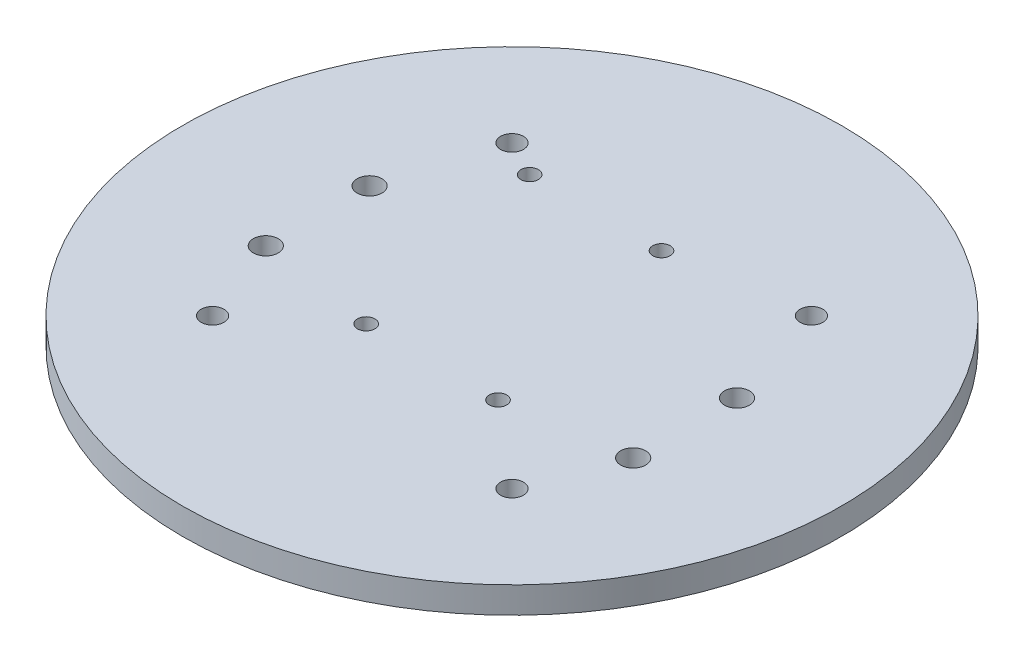
from build123d import *

# Parameters (mm, degrees)
SKETCH1_R                   = 79.375
BOSS_EXTRUDE1_DEPTH         = 3.175
TAP_DRILL_FOR_M5X0_8_TAP1_D = 4.2
TAP_DRILL_FOR_M7X1_0_TAP1_D = 6
M5_CLEARANCE_HOLE1_D        = 5.5


with BuildPart() as part:
    # Sketch1 → Boss-Extrude1 (new, symmetric)
    with BuildSketch(Plane(origin=(0, 0, 0), x_dir=(1, 0, 0), z_dir=(0, 1, 0))):
        Circle(SKETCH1_R)
    extrude(amount=BOSS_EXTRUDE1_DEPTH, both=True)

    # Tap Drill for M5x0.8 Tap1 (through all)
    with Locations(Plane(origin=(0, 3.175, 0), x_dir=(1, 0, 0), z_dir=(0, 1, 0))):
        with Locations((-27.3188086, 31.571183672), (4.4311914, 31.571183672), (-15.875, -19.245910728), (15.875, -19.245910728)):
            Hole(TAP_DRILL_FOR_M5X0_8_TAP1_D / 2)

    # Tap Drill for M7x1.0 Tap1 (through all)
    with Locations(Plane(origin=(0, 3.175, 0), x_dir=(1, 0, 0), z_dir=(0, 1, 0))):
        with Locations((-44.245, 9.941583672), (-44.245, -15.058416328), (44.245, 9.941583672), (44.245, -15.058416328)):
            Hole(TAP_DRILL_FOR_M7X1_0_TAP1_D / 2)

    # M5 Clearance Hole1 (through all)
    with Locations(Plane(origin=(0, 3.175, 0), x_dir=(1, 0, 0), z_dir=(0, 1, 0))):
        with Locations((-36.062445841, 36.062445841), (-36.062445841, -36.062445841), (36.062445841, -36.062445841), (36.062445841, 36.062445841)):
            Hole(M5_CLEARANCE_HOLE1_D / 2)


solid = part.part
